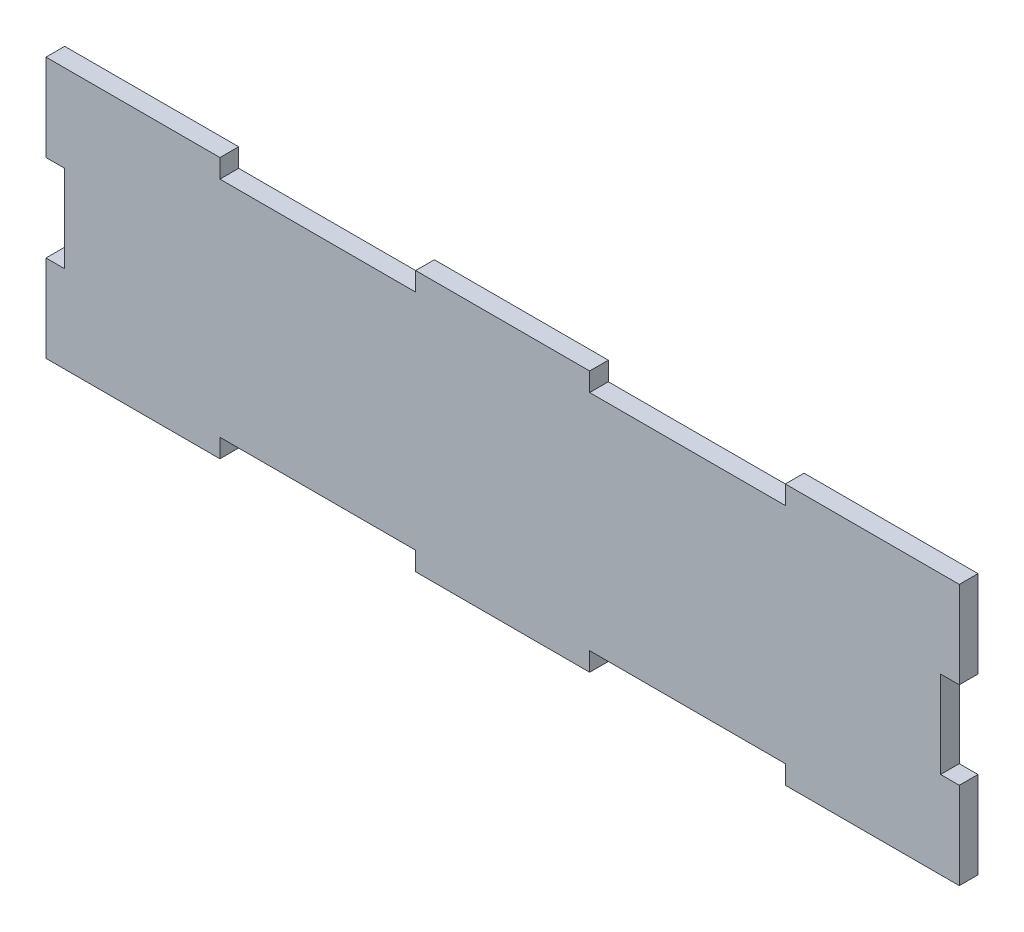
from build123d import *

# Parameters (mm, degrees)
SKETCH1_W           = 266.7
SKETCH1_H           = 76.2
BOSS_EXTRUDE1_DEPTH = 2.7305
CAVITY1_START       = -38.1
CAVITY1_OUTLINE_W   = 57.15
CAVITY1_OUTLINE_H   = 5.461
CAVITY1_DEPTH       = 5.461
CAVITY1_START_2     = 32.639
CAVITY1_2_OUTLINE_W = 57.15
CAVITY1_2_OUTLINE_H = 5.461
CAVITY1_2_DEPTH     = 5.461
SKETCH2_W           = 5.461
SKETCH2_H           = 25.4
CUT_EXTRUDE1_DEPTH  = 139.793569811


# Read off the part's stored shape, not the designer's step: Cavity1
with BuildPart() as part:
    # Sketch1 → Boss-Extrude1 (new, symmetric)
    with BuildSketch(Plane.XY):
        Rectangle(SKETCH1_W, SKETCH1_H)
    extrude(amount=BOSS_EXTRUDE1_DEPTH, both=True)

    # Cavity1 outline → Cavity1 (cut)
    with BuildSketch(Plane(origin=(0, 0, 0), x_dir=(1, 0, 0), z_dir=(0, 1, 0)).offset(CAVITY1_START)):
        with Locations((-53.975, 0)):
            Rectangle(CAVITY1_OUTLINE_W, CAVITY1_OUTLINE_H)
        with Locations((53.975, 0)):
            Rectangle(CAVITY1_OUTLINE_W, CAVITY1_OUTLINE_H)
    extrude(amount=CAVITY1_DEPTH, mode=Mode.SUBTRACT)

    # Cavity1 2 outline → Cavity1 2 (cut)
    with BuildSketch(Plane(origin=(0, 0, 0), x_dir=(1, 0, 0), z_dir=(0, 1, 0)).offset(CAVITY1_START_2)):
        with Locations((-53.975, 0)):
            Rectangle(CAVITY1_2_OUTLINE_W, CAVITY1_2_OUTLINE_H)
        with Locations((53.975, 0)):
            Rectangle(CAVITY1_2_OUTLINE_W, CAVITY1_2_OUTLINE_H)
    extrude(amount=CAVITY1_2_DEPTH, mode=Mode.SUBTRACT)

    # Sketch2 → Cut-Extrude1 (cut, through all)
    with BuildSketch(Plane.XY.offset(2.7305)):
        with Locations((-130.6195, 0)):
            Rectangle(SKETCH2_W, SKETCH2_H)
    cut_extrude1 = extrude(amount=-CUT_EXTRUDE1_DEPTH, mode=Mode.SUBTRACT)

    # Mirror1: Cut-Extrude1 across plane
    add(cut_extrude1.mirror(Plane(origin=(0, 0, 0), x_dir=(0, 0, 1), z_dir=(1, 0, 0))), mode=Mode.SUBTRACT)


solid = part.part
